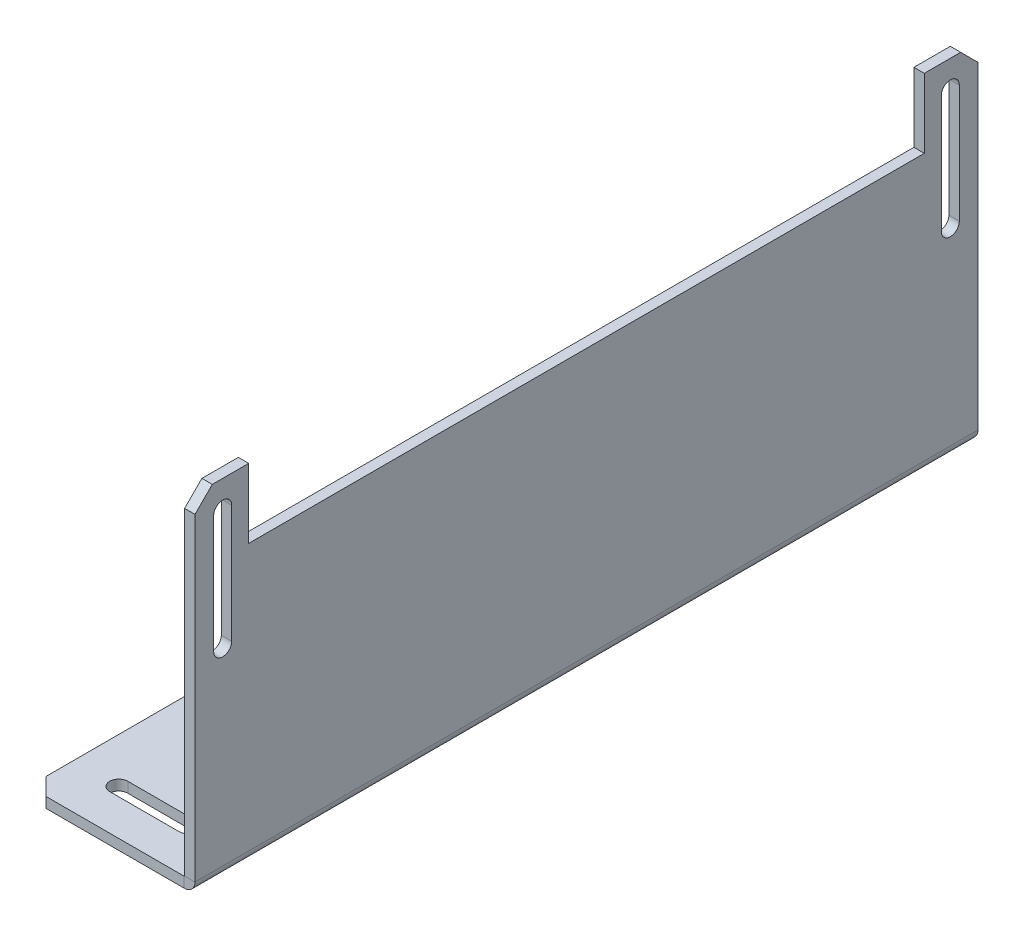
from build123d import *

# Parameters (mm, degrees)
SM_BASE_FLANGE_1_DEPTH = 113
CUT_EXTRUDE_1_DEPTH    = 10
CUT_EXTRUDE_2_DEPTH    = 10
CHAMFER_1_SIZE         = 5
SKETCH_8_W             = 195
SKETCH_8_H             = 40
CUT_EXTRUDE_3_DEPTH    = 10


# Sheet-metal steps are written as plain solids
with BuildPart() as part:
    # Sketch 1 → 基体-法兰1 (new, symmetric)
    with BuildSketch(Plane.XY):
        with BuildLine():
            Line((0, 100), (0, 3.1))
            ThreePointArc((0, 3.1), (-0.907968978, 0.907968978), (-3.1, 0))
            Line((-3.1, 0), (-48, 0))
            Line((-48, 0), (-48, 3))
            Line((-48, 3), (-3.1, 3))
            ThreePointArc((-3.1, 3), (-3.029289322, 3.029289322), (-3, 3.1))
            Line((-3, 3.1), (-3, 100))
            Line((-3, 100), (0, 100))
        make_face()
    extrude(amount=SM_BASE_FLANGE_1_DEPTH, both=True)

    # 草图6 → 切除-拉伸1 (cut)
    with BuildSketch(Plane.ZY.offset(3)):
        with BuildLine():
            Line((-102.4, 92), (-102.4, 58))
            ThreePointArc((-102.4, 58), (-105, 55.4), (-107.6, 58))
            Line((-107.6, 58), (-107.6, 92))
            ThreePointArc((-107.6, 92), (-105, 94.6), (-102.4, 92))
        make_face()
        with BuildLine():
            Line((107.6, 92), (107.6, 58))
            ThreePointArc((107.6, 58), (105, 55.4), (102.4, 58))
            Line((102.4, 58), (102.4, 92))
            ThreePointArc((102.4, 92), (105, 94.6), (107.6, 92))
        make_face()
    extrude(amount=-CUT_EXTRUDE_1_DEPTH, mode=Mode.SUBTRACT)

    # 草图7 → 切除-拉伸2 (cut)
    with BuildSketch(Plane(origin=(0, 3, 0), x_dir=(1, 0, 0), z_dir=(0, 1, 0))):
        with BuildLine():
            Line((-35, 102.6), (-15, 102.6))
            ThreePointArc((-15, 102.6), (-12.4, 100), (-15, 97.4))
            Line((-15, 97.4), (-35, 97.4))
            ThreePointArc((-35, 97.4), (-37.6, 100), (-35, 102.6))
        make_face()
        with BuildLine():
            Line((-35, 2.6), (-15, 2.6))
            ThreePointArc((-15, 2.6), (-12.4, 0), (-15, -2.6))
            Line((-15, -2.6), (-35, -2.6))
            ThreePointArc((-35, -2.6), (-37.6, 0), (-35, 2.6))
        make_face()
        with BuildLine():
            Line((-35, -97.4), (-15, -97.4))
            ThreePointArc((-15, -97.4), (-12.4, -100), (-15, -102.6))
            Line((-15, -102.6), (-35, -102.6))
            ThreePointArc((-35, -102.6), (-37.6, -100), (-35, -97.4))
        make_face()
    extrude(amount=-CUT_EXTRUDE_2_DEPTH, mode=Mode.SUBTRACT)

    # 倒角1
    chamfer_1_edges = [part.edges().sort_by_distance(p)[0] for p in [
        (-1.5, 100, 113),
        (-48, 1.5, 113),
        (-1.5, 100, -113),
        (-48, 1.5, -113),
    ]]
    chamfer(chamfer_1_edges, length=CHAMFER_1_SIZE)

    # 草图8 → 切除-拉伸3 (cut)
    with BuildSketch(Plane.ZY.offset(3)):
        with Locations((0, 100)):
            Rectangle(SKETCH_8_W, SKETCH_8_H)
    extrude(amount=-CUT_EXTRUDE_3_DEPTH, mode=Mode.SUBTRACT)


solid = part.part
